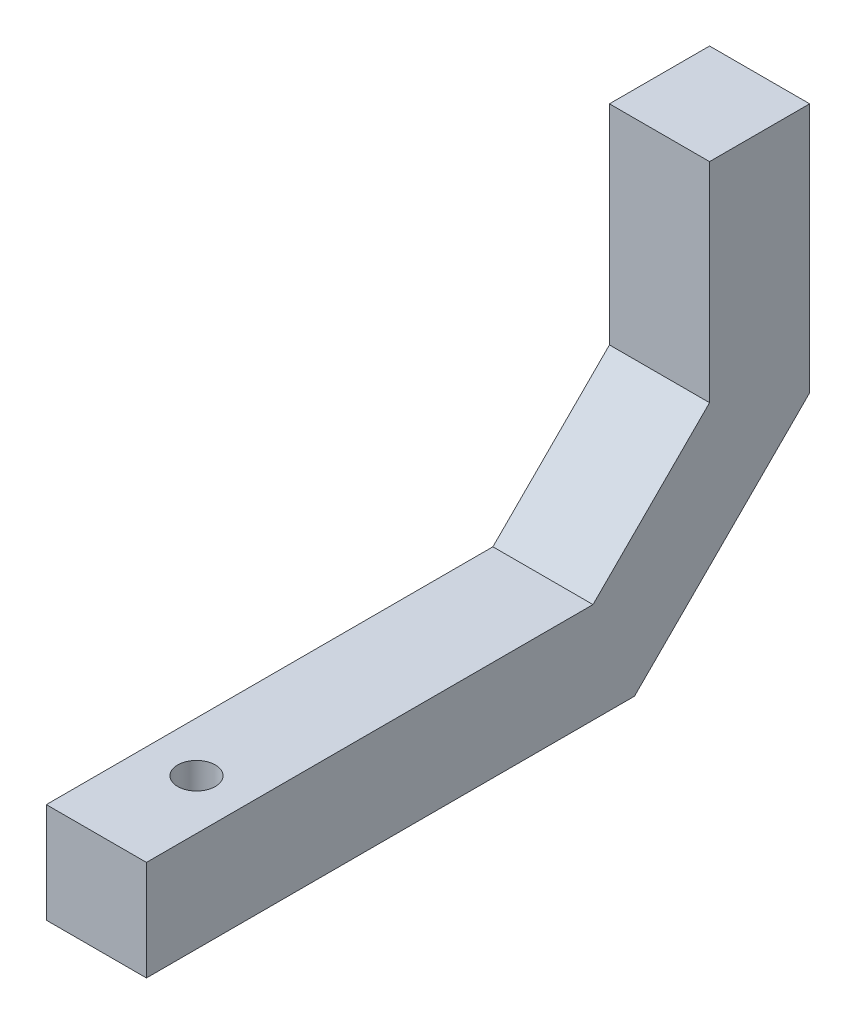
from build123d import *

# Parameters (mm, degrees)
BOSS_EXTRUDE1_DEPTH      = 4
BOSS_EXTRUDE1_DEPTH_BACK = 4
SKETCH3_R                = 1.5
CUT_EXTRUDE1_DEPTH       = 60.16924877


with BuildPart() as part:
    # Sketch1 → Boss-Extrude1 (new, two sides: drawn at the far end of the back side and taken through both)
    with BuildSketch(Plane(origin=(0, 0, 0), x_dir=(0, 0, -1), z_dir=(1, 0, 0)).offset(-BOSS_EXTRUDE1_DEPTH_BACK)):
        Polygon((-8, 4), (0, 4), (0, -16), (-14, -30), (-45, -30), (-53, -30), (-53, -22), (-45, -22), (-17.313708499, -22), (-8, -12.686291501), align=None)
    extrude(amount=BOSS_EXTRUDE1_DEPTH + BOSS_EXTRUDE1_DEPTH_BACK)

    # Sketch3 → Cut-Extrude1 (cut, through all)
    with BuildSketch(Plane(origin=(0, -22, 0), x_dir=(1, 0, 0), z_dir=(0, 1, 0))):
        with Locations((0, -45)):
            Circle(SKETCH3_R)
    extrude(amount=-CUT_EXTRUDE1_DEPTH, mode=Mode.SUBTRACT)


solid = part.part
